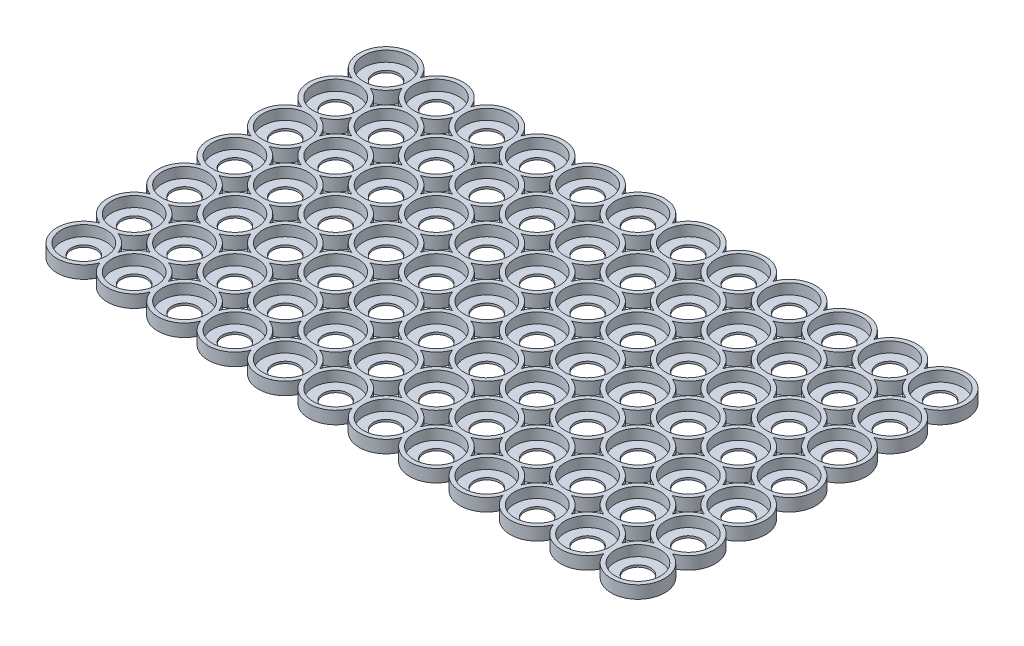
from build123d import *

# Parameters (mm, degrees)
LPATTERN1_COUNT = 7
LPATTERN1_PITCH = 24
LPATTERN2_COUNT = 12
LPATTERN2_PITCH = 24


with BuildPart() as part:
    # Sketch1 → Revolve1 (revolve)
    with BuildSketch(Plane(origin=(0, 0, 0), x_dir=(0, 0, -1), z_dir=(1, 0, 0))):
        Polygon((-12.75, 3), (-12.75, -3), (-6, -3), (-6, -2), (-10.75, -2), (-10.75, 3), align=None)
    revolve1 = revolve(axis=Axis((0, 27.077205882, 0), (0, -1, 0)))

    # LPattern1: Revolve1 ×7
    with Locations(*[(0, 0, -i * LPATTERN1_PITCH) for i in range(1, LPATTERN1_COUNT)]):
        add(revolve1)

    # LPattern2: Revolve1 ×12
    with Locations(*[(i * LPATTERN2_PITCH, 0, 0) for i in range(1, LPATTERN2_COUNT)]):
        add(revolve1)

    # LPattern2 copy 1 sketch → LPattern2 copy 1 (revolve)
    with BuildSketch(Plane(origin=(24, 0, -24), x_dir=(0, 0, -1), z_dir=(1, 0, 0))):
        Polygon((-12.75, 3), (-12.75, -3), (-6, -3), (-6, -2), (-10.75, -2), (-10.75, 3), align=None)
    revolve(axis=Axis((24, 27.077205882, -24), (0, -1, 0)))

    # LPattern2 copy 2 sketch → LPattern2 copy 2 (revolve)
    with BuildSketch(Plane(origin=(48, 0, -24), x_dir=(0, 0, -1), z_dir=(1, 0, 0))):
        Polygon((-12.75, 3), (-12.75, -3), (-6, -3), (-6, -2), (-10.75, -2), (-10.75, 3), align=None)
    revolve(axis=Axis((48, 27.077205882, -24), (0, -1, 0)))

    # LPattern2 copy 3 sketch → LPattern2 copy 3 (revolve)
    with BuildSketch(Plane(origin=(72, 0, -24), x_dir=(0, 0, -1), z_dir=(1, 0, 0))):
        Polygon((-12.75, 3), (-12.75, -3), (-6, -3), (-6, -2), (-10.75, -2), (-10.75, 3), align=None)
    revolve(axis=Axis((72, 27.077205882, -24), (0, -1, 0)))

    # LPattern2 copy 4 sketch → LPattern2 copy 4 (revolve)
    with BuildSketch(Plane(origin=(96, 0, -24), x_dir=(0, 0, -1), z_dir=(1, 0, 0))):
        Polygon((-12.75, 3), (-12.75, -3), (-6, -3), (-6, -2), (-10.75, -2), (-10.75, 3), align=None)
    revolve(axis=Axis((96, 27.077205882, -24), (0, -1, 0)))

    # LPattern2 copy 5 sketch → LPattern2 copy 5 (revolve)
    with BuildSketch(Plane(origin=(120, 0, -24), x_dir=(0, 0, -1), z_dir=(1, 0, 0))):
        Polygon((-12.75, 3), (-12.75, -3), (-6, -3), (-6, -2), (-10.75, -2), (-10.75, 3), align=None)
    revolve(axis=Axis((120, 27.077205882, -24), (0, -1, 0)))

    # LPattern2 copy 6 sketch → LPattern2 copy 6 (revolve)
    with BuildSketch(Plane(origin=(144, 0, -24), x_dir=(0, 0, -1), z_dir=(1, 0, 0))):
        Polygon((-12.75, 3), (-12.75, -3), (-6, -3), (-6, -2), (-10.75, -2), (-10.75, 3), align=None)
    revolve(axis=Axis((144, 27.077205882, -24), (0, -1, 0)))

    # LPattern2 copy 7 sketch → LPattern2 copy 7 (revolve)
    with BuildSketch(Plane(origin=(168, 0, -24), x_dir=(0, 0, -1), z_dir=(1, 0, 0))):
        Polygon((-12.75, 3), (-12.75, -3), (-6, -3), (-6, -2), (-10.75, -2), (-10.75, 3), align=None)
    revolve(axis=Axis((168, 27.077205882, -24), (0, -1, 0)))

    # LPattern2 copy 8 sketch → LPattern2 copy 8 (revolve)
    with BuildSketch(Plane(origin=(192, 0, -24), x_dir=(0, 0, -1), z_dir=(1, 0, 0))):
        Polygon((-12.75, 3), (-12.75, -3), (-6, -3), (-6, -2), (-10.75, -2), (-10.75, 3), align=None)
    revolve(axis=Axis((192, 27.077205882, -24), (0, -1, 0)))

    # LPattern2 copy 9 sketch → LPattern2 copy 9 (revolve)
    with BuildSketch(Plane(origin=(216, 0, -24), x_dir=(0, 0, -1), z_dir=(1, 0, 0))):
        Polygon((-12.75, 3), (-12.75, -3), (-6, -3), (-6, -2), (-10.75, -2), (-10.75, 3), align=None)
    revolve(axis=Axis((216, 27.077205882, -24), (0, -1, 0)))

    # LPattern2 copy 10 sketch → LPattern2 copy 10 (revolve)
    with BuildSketch(Plane(origin=(240, 0, -24), x_dir=(0, 0, -1), z_dir=(1, 0, 0))):
        Polygon((-12.75, 3), (-12.75, -3), (-6, -3), (-6, -2), (-10.75, -2), (-10.75, 3), align=None)
    revolve(axis=Axis((240, 27.077205882, -24), (0, -1, 0)))

    # LPattern2 copy 11 sketch → LPattern2 copy 11 (revolve)
    with BuildSketch(Plane(origin=(264, 0, -24), x_dir=(0, 0, -1), z_dir=(1, 0, 0))):
        Polygon((-12.75, 3), (-12.75, -3), (-6, -3), (-6, -2), (-10.75, -2), (-10.75, 3), align=None)
    revolve(axis=Axis((264, 27.077205882, -24), (0, -1, 0)))

    # LPattern2 copy 12 sketch → LPattern2 copy 12 (revolve)
    with BuildSketch(Plane(origin=(24, 0, -48), x_dir=(0, 0, -1), z_dir=(1, 0, 0))):
        Polygon((-12.75, 3), (-12.75, -3), (-6, -3), (-6, -2), (-10.75, -2), (-10.75, 3), align=None)
    revolve(axis=Axis((24, 27.077205882, -48), (0, -1, 0)))

    # LPattern2 copy 13 sketch → LPattern2 copy 13 (revolve)
    with BuildSketch(Plane(origin=(48, 0, -48), x_dir=(0, 0, -1), z_dir=(1, 0, 0))):
        Polygon((-12.75, 3), (-12.75, -3), (-6, -3), (-6, -2), (-10.75, -2), (-10.75, 3), align=None)
    revolve(axis=Axis((48, 27.077205882, -48), (0, -1, 0)))

    # LPattern2 copy 14 sketch → LPattern2 copy 14 (revolve)
    with BuildSketch(Plane(origin=(72, 0, -48), x_dir=(0, 0, -1), z_dir=(1, 0, 0))):
        Polygon((-12.75, 3), (-12.75, -3), (-6, -3), (-6, -2), (-10.75, -2), (-10.75, 3), align=None)
    revolve(axis=Axis((72, 27.077205882, -48), (0, -1, 0)))

    # LPattern2 copy 15 sketch → LPattern2 copy 15 (revolve)
    with BuildSketch(Plane(origin=(96, 0, -48), x_dir=(0, 0, -1), z_dir=(1, 0, 0))):
        Polygon((-12.75, 3), (-12.75, -3), (-6, -3), (-6, -2), (-10.75, -2), (-10.75, 3), align=None)
    revolve(axis=Axis((96, 27.077205882, -48), (0, -1, 0)))

    # LPattern2 copy 16 sketch → LPattern2 copy 16 (revolve)
    with BuildSketch(Plane(origin=(120, 0, -48), x_dir=(0, 0, -1), z_dir=(1, 0, 0))):
        Polygon((-12.75, 3), (-12.75, -3), (-6, -3), (-6, -2), (-10.75, -2), (-10.75, 3), align=None)
    revolve(axis=Axis((120, 27.077205882, -48), (0, -1, 0)))

    # LPattern2 copy 17 sketch → LPattern2 copy 17 (revolve)
    with BuildSketch(Plane(origin=(144, 0, -48), x_dir=(0, 0, -1), z_dir=(1, 0, 0))):
        Polygon((-12.75, 3), (-12.75, -3), (-6, -3), (-6, -2), (-10.75, -2), (-10.75, 3), align=None)
    revolve(axis=Axis((144, 27.077205882, -48), (0, -1, 0)))

    # LPattern2 copy 18 sketch → LPattern2 copy 18 (revolve)
    with BuildSketch(Plane(origin=(168, 0, -48), x_dir=(0, 0, -1), z_dir=(1, 0, 0))):
        Polygon((-12.75, 3), (-12.75, -3), (-6, -3), (-6, -2), (-10.75, -2), (-10.75, 3), align=None)
    revolve(axis=Axis((168, 27.077205882, -48), (0, -1, 0)))

    # LPattern2 copy 19 sketch → LPattern2 copy 19 (revolve)
    with BuildSketch(Plane(origin=(192, 0, -48), x_dir=(0, 0, -1), z_dir=(1, 0, 0))):
        Polygon((-12.75, 3), (-12.75, -3), (-6, -3), (-6, -2), (-10.75, -2), (-10.75, 3), align=None)
    revolve(axis=Axis((192, 27.077205882, -48), (0, -1, 0)))

    # LPattern2 copy 20 sketch → LPattern2 copy 20 (revolve)
    with BuildSketch(Plane(origin=(216, 0, -48), x_dir=(0, 0, -1), z_dir=(1, 0, 0))):
        Polygon((-12.75, 3), (-12.75, -3), (-6, -3), (-6, -2), (-10.75, -2), (-10.75, 3), align=None)
    revolve(axis=Axis((216, 27.077205882, -48), (0, -1, 0)))

    # LPattern2 copy 21 sketch → LPattern2 copy 21 (revolve)
    with BuildSketch(Plane(origin=(240, 0, -48), x_dir=(0, 0, -1), z_dir=(1, 0, 0))):
        Polygon((-12.75, 3), (-12.75, -3), (-6, -3), (-6, -2), (-10.75, -2), (-10.75, 3), align=None)
    revolve(axis=Axis((240, 27.077205882, -48), (0, -1, 0)))

    # LPattern2 copy 22 sketch → LPattern2 copy 22 (revolve)
    with BuildSketch(Plane(origin=(264, 0, -48), x_dir=(0, 0, -1), z_dir=(1, 0, 0))):
        Polygon((-12.75, 3), (-12.75, -3), (-6, -3), (-6, -2), (-10.75, -2), (-10.75, 3), align=None)
    revolve(axis=Axis((264, 27.077205882, -48), (0, -1, 0)))

    # LPattern2 copy 23 sketch → LPattern2 copy 23 (revolve)
    with BuildSketch(Plane(origin=(24, 0, -72), x_dir=(0, 0, -1), z_dir=(1, 0, 0))):
        Polygon((-12.75, 3), (-12.75, -3), (-6, -3), (-6, -2), (-10.75, -2), (-10.75, 3), align=None)
    revolve(axis=Axis((24, 27.077205882, -72), (0, -1, 0)))

    # LPattern2 copy 24 sketch → LPattern2 copy 24 (revolve)
    with BuildSketch(Plane(origin=(48, 0, -72), x_dir=(0, 0, -1), z_dir=(1, 0, 0))):
        Polygon((-12.75, 3), (-12.75, -3), (-6, -3), (-6, -2), (-10.75, -2), (-10.75, 3), align=None)
    revolve(axis=Axis((48, 27.077205882, -72), (0, -1, 0)))

    # LPattern2 copy 25 sketch → LPattern2 copy 25 (revolve)
    with BuildSketch(Plane(origin=(72, 0, -72), x_dir=(0, 0, -1), z_dir=(1, 0, 0))):
        Polygon((-12.75, 3), (-12.75, -3), (-6, -3), (-6, -2), (-10.75, -2), (-10.75, 3), align=None)
    revolve(axis=Axis((72, 27.077205882, -72), (0, -1, 0)))

    # LPattern2 copy 26 sketch → LPattern2 copy 26 (revolve)
    with BuildSketch(Plane(origin=(96, 0, -72), x_dir=(0, 0, -1), z_dir=(1, 0, 0))):
        Polygon((-12.75, 3), (-12.75, -3), (-6, -3), (-6, -2), (-10.75, -2), (-10.75, 3), align=None)
    revolve(axis=Axis((96, 27.077205882, -72), (0, -1, 0)))

    # LPattern2 copy 27 sketch → LPattern2 copy 27 (revolve)
    with BuildSketch(Plane(origin=(120, 0, -72), x_dir=(0, 0, -1), z_dir=(1, 0, 0))):
        Polygon((-12.75, 3), (-12.75, -3), (-6, -3), (-6, -2), (-10.75, -2), (-10.75, 3), align=None)
    revolve(axis=Axis((120, 27.077205882, -72), (0, -1, 0)))

    # LPattern2 copy 28 sketch → LPattern2 copy 28 (revolve)
    with BuildSketch(Plane(origin=(144, 0, -72), x_dir=(0, 0, -1), z_dir=(1, 0, 0))):
        Polygon((-12.75, 3), (-12.75, -3), (-6, -3), (-6, -2), (-10.75, -2), (-10.75, 3), align=None)
    revolve(axis=Axis((144, 27.077205882, -72), (0, -1, 0)))

    # LPattern2 copy 29 sketch → LPattern2 copy 29 (revolve)
    with BuildSketch(Plane(origin=(168, 0, -72), x_dir=(0, 0, -1), z_dir=(1, 0, 0))):
        Polygon((-12.75, 3), (-12.75, -3), (-6, -3), (-6, -2), (-10.75, -2), (-10.75, 3), align=None)
    revolve(axis=Axis((168, 27.077205882, -72), (0, -1, 0)))

    # LPattern2 copy 30 sketch → LPattern2 copy 30 (revolve)
    with BuildSketch(Plane(origin=(192, 0, -72), x_dir=(0, 0, -1), z_dir=(1, 0, 0))):
        Polygon((-12.75, 3), (-12.75, -3), (-6, -3), (-6, -2), (-10.75, -2), (-10.75, 3), align=None)
    revolve(axis=Axis((192, 27.077205882, -72), (0, -1, 0)))

    # LPattern2 copy 31 sketch → LPattern2 copy 31 (revolve)
    with BuildSketch(Plane(origin=(216, 0, -72), x_dir=(0, 0, -1), z_dir=(1, 0, 0))):
        Polygon((-12.75, 3), (-12.75, -3), (-6, -3), (-6, -2), (-10.75, -2), (-10.75, 3), align=None)
    revolve(axis=Axis((216, 27.077205882, -72), (0, -1, 0)))

    # LPattern2 copy 32 sketch → LPattern2 copy 32 (revolve)
    with BuildSketch(Plane(origin=(240, 0, -72), x_dir=(0, 0, -1), z_dir=(1, 0, 0))):
        Polygon((-12.75, 3), (-12.75, -3), (-6, -3), (-6, -2), (-10.75, -2), (-10.75, 3), align=None)
    revolve(axis=Axis((240, 27.077205882, -72), (0, -1, 0)))

    # LPattern2 copy 33 sketch → LPattern2 copy 33 (revolve)
    with BuildSketch(Plane(origin=(264, 0, -72), x_dir=(0, 0, -1), z_dir=(1, 0, 0))):
        Polygon((-12.75, 3), (-12.75, -3), (-6, -3), (-6, -2), (-10.75, -2), (-10.75, 3), align=None)
    revolve(axis=Axis((264, 27.077205882, -72), (0, -1, 0)))

    # LPattern2 copy 34 sketch → LPattern2 copy 34 (revolve)
    with BuildSketch(Plane(origin=(24, 0, -96), x_dir=(0, 0, -1), z_dir=(1, 0, 0))):
        Polygon((-12.75, 3), (-12.75, -3), (-6, -3), (-6, -2), (-10.75, -2), (-10.75, 3), align=None)
    revolve(axis=Axis((24, 27.077205882, -96), (0, -1, 0)))

    # LPattern2 copy 35 sketch → LPattern2 copy 35 (revolve)
    with BuildSketch(Plane(origin=(48, 0, -96), x_dir=(0, 0, -1), z_dir=(1, 0, 0))):
        Polygon((-12.75, 3), (-12.75, -3), (-6, -3), (-6, -2), (-10.75, -2), (-10.75, 3), align=None)
    revolve(axis=Axis((48, 27.077205882, -96), (0, -1, 0)))

    # LPattern2 copy 36 sketch → LPattern2 copy 36 (revolve)
    with BuildSketch(Plane(origin=(72, 0, -96), x_dir=(0, 0, -1), z_dir=(1, 0, 0))):
        Polygon((-12.75, 3), (-12.75, -3), (-6, -3), (-6, -2), (-10.75, -2), (-10.75, 3), align=None)
    revolve(axis=Axis((72, 27.077205882, -96), (0, -1, 0)))

    # LPattern2 copy 37 sketch → LPattern2 copy 37 (revolve)
    with BuildSketch(Plane(origin=(96, 0, -96), x_dir=(0, 0, -1), z_dir=(1, 0, 0))):
        Polygon((-12.75, 3), (-12.75, -3), (-6, -3), (-6, -2), (-10.75, -2), (-10.75, 3), align=None)
    revolve(axis=Axis((96, 27.077205882, -96), (0, -1, 0)))

    # LPattern2 copy 38 sketch → LPattern2 copy 38 (revolve)
    with BuildSketch(Plane(origin=(120, 0, -96), x_dir=(0, 0, -1), z_dir=(1, 0, 0))):
        Polygon((-12.75, 3), (-12.75, -3), (-6, -3), (-6, -2), (-10.75, -2), (-10.75, 3), align=None)
    revolve(axis=Axis((120, 27.077205882, -96), (0, -1, 0)))

    # LPattern2 copy 39 sketch → LPattern2 copy 39 (revolve)
    with BuildSketch(Plane(origin=(144, 0, -96), x_dir=(0, 0, -1), z_dir=(1, 0, 0))):
        Polygon((-12.75, 3), (-12.75, -3), (-6, -3), (-6, -2), (-10.75, -2), (-10.75, 3), align=None)
    revolve(axis=Axis((144, 27.077205882, -96), (0, -1, 0)))

    # LPattern2 copy 40 sketch → LPattern2 copy 40 (revolve)
    with BuildSketch(Plane(origin=(168, 0, -96), x_dir=(0, 0, -1), z_dir=(1, 0, 0))):
        Polygon((-12.75, 3), (-12.75, -3), (-6, -3), (-6, -2), (-10.75, -2), (-10.75, 3), align=None)
    revolve(axis=Axis((168, 27.077205882, -96), (0, -1, 0)))

    # LPattern2 copy 41 sketch → LPattern2 copy 41 (revolve)
    with BuildSketch(Plane(origin=(192, 0, -96), x_dir=(0, 0, -1), z_dir=(1, 0, 0))):
        Polygon((-12.75, 3), (-12.75, -3), (-6, -3), (-6, -2), (-10.75, -2), (-10.75, 3), align=None)
    revolve(axis=Axis((192, 27.077205882, -96), (0, -1, 0)))

    # LPattern2 copy 42 sketch → LPattern2 copy 42 (revolve)
    with BuildSketch(Plane(origin=(216, 0, -96), x_dir=(0, 0, -1), z_dir=(1, 0, 0))):
        Polygon((-12.75, 3), (-12.75, -3), (-6, -3), (-6, -2), (-10.75, -2), (-10.75, 3), align=None)
    revolve(axis=Axis((216, 27.077205882, -96), (0, -1, 0)))

    # LPattern2 copy 43 sketch → LPattern2 copy 43 (revolve)
    with BuildSketch(Plane(origin=(240, 0, -96), x_dir=(0, 0, -1), z_dir=(1, 0, 0))):
        Polygon((-12.75, 3), (-12.75, -3), (-6, -3), (-6, -2), (-10.75, -2), (-10.75, 3), align=None)
    revolve(axis=Axis((240, 27.077205882, -96), (0, -1, 0)))

    # LPattern2 copy 44 sketch → LPattern2 copy 44 (revolve)
    with BuildSketch(Plane(origin=(264, 0, -96), x_dir=(0, 0, -1), z_dir=(1, 0, 0))):
        Polygon((-12.75, 3), (-12.75, -3), (-6, -3), (-6, -2), (-10.75, -2), (-10.75, 3), align=None)
    revolve(axis=Axis((264, 27.077205882, -96), (0, -1, 0)))

    # LPattern2 copy 45 sketch → LPattern2 copy 45 (revolve)
    with BuildSketch(Plane(origin=(24, 0, -120), x_dir=(0, 0, -1), z_dir=(1, 0, 0))):
        Polygon((-12.75, 3), (-12.75, -3), (-6, -3), (-6, -2), (-10.75, -2), (-10.75, 3), align=None)
    revolve(axis=Axis((24, 27.077205882, -120), (0, -1, 0)))

    # LPattern2 copy 46 sketch → LPattern2 copy 46 (revolve)
    with BuildSketch(Plane(origin=(48, 0, -120), x_dir=(0, 0, -1), z_dir=(1, 0, 0))):
        Polygon((-12.75, 3), (-12.75, -3), (-6, -3), (-6, -2), (-10.75, -2), (-10.75, 3), align=None)
    revolve(axis=Axis((48, 27.077205882, -120), (0, -1, 0)))

    # LPattern2 copy 47 sketch → LPattern2 copy 47 (revolve)
    with BuildSketch(Plane(origin=(72, 0, -120), x_dir=(0, 0, -1), z_dir=(1, 0, 0))):
        Polygon((-12.75, 3), (-12.75, -3), (-6, -3), (-6, -2), (-10.75, -2), (-10.75, 3), align=None)
    revolve(axis=Axis((72, 27.077205882, -120), (0, -1, 0)))

    # LPattern2 copy 48 sketch → LPattern2 copy 48 (revolve)
    with BuildSketch(Plane(origin=(96, 0, -120), x_dir=(0, 0, -1), z_dir=(1, 0, 0))):
        Polygon((-12.75, 3), (-12.75, -3), (-6, -3), (-6, -2), (-10.75, -2), (-10.75, 3), align=None)
    revolve(axis=Axis((96, 27.077205882, -120), (0, -1, 0)))

    # LPattern2 copy 49 sketch → LPattern2 copy 49 (revolve)
    with BuildSketch(Plane(origin=(120, 0, -120), x_dir=(0, 0, -1), z_dir=(1, 0, 0))):
        Polygon((-12.75, 3), (-12.75, -3), (-6, -3), (-6, -2), (-10.75, -2), (-10.75, 3), align=None)
    revolve(axis=Axis((120, 27.077205882, -120), (0, -1, 0)))

    # LPattern2 copy 50 sketch → LPattern2 copy 50 (revolve)
    with BuildSketch(Plane(origin=(144, 0, -120), x_dir=(0, 0, -1), z_dir=(1, 0, 0))):
        Polygon((-12.75, 3), (-12.75, -3), (-6, -3), (-6, -2), (-10.75, -2), (-10.75, 3), align=None)
    revolve(axis=Axis((144, 27.077205882, -120), (0, -1, 0)))

    # LPattern2 copy 51 sketch → LPattern2 copy 51 (revolve)
    with BuildSketch(Plane(origin=(168, 0, -120), x_dir=(0, 0, -1), z_dir=(1, 0, 0))):
        Polygon((-12.75, 3), (-12.75, -3), (-6, -3), (-6, -2), (-10.75, -2), (-10.75, 3), align=None)
    revolve(axis=Axis((168, 27.077205882, -120), (0, -1, 0)))

    # LPattern2 copy 52 sketch → LPattern2 copy 52 (revolve)
    with BuildSketch(Plane(origin=(192, 0, -120), x_dir=(0, 0, -1), z_dir=(1, 0, 0))):
        Polygon((-12.75, 3), (-12.75, -3), (-6, -3), (-6, -2), (-10.75, -2), (-10.75, 3), align=None)
    revolve(axis=Axis((192, 27.077205882, -120), (0, -1, 0)))

    # LPattern2 copy 53 sketch → LPattern2 copy 53 (revolve)
    with BuildSketch(Plane(origin=(216, 0, -120), x_dir=(0, 0, -1), z_dir=(1, 0, 0))):
        Polygon((-12.75, 3), (-12.75, -3), (-6, -3), (-6, -2), (-10.75, -2), (-10.75, 3), align=None)
    revolve(axis=Axis((216, 27.077205882, -120), (0, -1, 0)))

    # LPattern2 copy 54 sketch → LPattern2 copy 54 (revolve)
    with BuildSketch(Plane(origin=(240, 0, -120), x_dir=(0, 0, -1), z_dir=(1, 0, 0))):
        Polygon((-12.75, 3), (-12.75, -3), (-6, -3), (-6, -2), (-10.75, -2), (-10.75, 3), align=None)
    revolve(axis=Axis((240, 27.077205882, -120), (0, -1, 0)))

    # LPattern2 copy 55 sketch → LPattern2 copy 55 (revolve)
    with BuildSketch(Plane(origin=(264, 0, -120), x_dir=(0, 0, -1), z_dir=(1, 0, 0))):
        Polygon((-12.75, 3), (-12.75, -3), (-6, -3), (-6, -2), (-10.75, -2), (-10.75, 3), align=None)
    revolve(axis=Axis((264, 27.077205882, -120), (0, -1, 0)))

    # LPattern2 copy 56 sketch → LPattern2 copy 56 (revolve)
    with BuildSketch(Plane(origin=(24, 0, -144), x_dir=(0, 0, -1), z_dir=(1, 0, 0))):
        Polygon((-12.75, 3), (-12.75, -3), (-6, -3), (-6, -2), (-10.75, -2), (-10.75, 3), align=None)
    revolve(axis=Axis((24, 27.077205882, -144), (0, -1, 0)))

    # LPattern2 copy 57 sketch → LPattern2 copy 57 (revolve)
    with BuildSketch(Plane(origin=(48, 0, -144), x_dir=(0, 0, -1), z_dir=(1, 0, 0))):
        Polygon((-12.75, 3), (-12.75, -3), (-6, -3), (-6, -2), (-10.75, -2), (-10.75, 3), align=None)
    revolve(axis=Axis((48, 27.077205882, -144), (0, -1, 0)))

    # LPattern2 copy 58 sketch → LPattern2 copy 58 (revolve)
    with BuildSketch(Plane(origin=(72, 0, -144), x_dir=(0, 0, -1), z_dir=(1, 0, 0))):
        Polygon((-12.75, 3), (-12.75, -3), (-6, -3), (-6, -2), (-10.75, -2), (-10.75, 3), align=None)
    revolve(axis=Axis((72, 27.077205882, -144), (0, -1, 0)))

    # LPattern2 copy 59 sketch → LPattern2 copy 59 (revolve)
    with BuildSketch(Plane(origin=(96, 0, -144), x_dir=(0, 0, -1), z_dir=(1, 0, 0))):
        Polygon((-12.75, 3), (-12.75, -3), (-6, -3), (-6, -2), (-10.75, -2), (-10.75, 3), align=None)
    revolve(axis=Axis((96, 27.077205882, -144), (0, -1, 0)))

    # LPattern2 copy 60 sketch → LPattern2 copy 60 (revolve)
    with BuildSketch(Plane(origin=(120, 0, -144), x_dir=(0, 0, -1), z_dir=(1, 0, 0))):
        Polygon((-12.75, 3), (-12.75, -3), (-6, -3), (-6, -2), (-10.75, -2), (-10.75, 3), align=None)
    revolve(axis=Axis((120, 27.077205882, -144), (0, -1, 0)))

    # LPattern2 copy 61 sketch → LPattern2 copy 61 (revolve)
    with BuildSketch(Plane(origin=(144, 0, -144), x_dir=(0, 0, -1), z_dir=(1, 0, 0))):
        Polygon((-12.75, 3), (-12.75, -3), (-6, -3), (-6, -2), (-10.75, -2), (-10.75, 3), align=None)
    revolve(axis=Axis((144, 27.077205882, -144), (0, -1, 0)))

    # LPattern2 copy 62 sketch → LPattern2 copy 62 (revolve)
    with BuildSketch(Plane(origin=(168, 0, -144), x_dir=(0, 0, -1), z_dir=(1, 0, 0))):
        Polygon((-12.75, 3), (-12.75, -3), (-6, -3), (-6, -2), (-10.75, -2), (-10.75, 3), align=None)
    revolve(axis=Axis((168, 27.077205882, -144), (0, -1, 0)))

    # LPattern2 copy 63 sketch → LPattern2 copy 63 (revolve)
    with BuildSketch(Plane(origin=(192, 0, -144), x_dir=(0, 0, -1), z_dir=(1, 0, 0))):
        Polygon((-12.75, 3), (-12.75, -3), (-6, -3), (-6, -2), (-10.75, -2), (-10.75, 3), align=None)
    revolve(axis=Axis((192, 27.077205882, -144), (0, -1, 0)))

    # LPattern2 copy 64 sketch → LPattern2 copy 64 (revolve)
    with BuildSketch(Plane(origin=(216, 0, -144), x_dir=(0, 0, -1), z_dir=(1, 0, 0))):
        Polygon((-12.75, 3), (-12.75, -3), (-6, -3), (-6, -2), (-10.75, -2), (-10.75, 3), align=None)
    revolve(axis=Axis((216, 27.077205882, -144), (0, -1, 0)))

    # LPattern2 copy 65 sketch → LPattern2 copy 65 (revolve)
    with BuildSketch(Plane(origin=(240, 0, -144), x_dir=(0, 0, -1), z_dir=(1, 0, 0))):
        Polygon((-12.75, 3), (-12.75, -3), (-6, -3), (-6, -2), (-10.75, -2), (-10.75, 3), align=None)
    revolve(axis=Axis((240, 27.077205882, -144), (0, -1, 0)))

    # LPattern2 copy 66 sketch → LPattern2 copy 66 (revolve)
    with BuildSketch(Plane(origin=(264, 0, -144), x_dir=(0, 0, -1), z_dir=(1, 0, 0))):
        Polygon((-12.75, 3), (-12.75, -3), (-6, -3), (-6, -2), (-10.75, -2), (-10.75, 3), align=None)
    revolve(axis=Axis((264, 27.077205882, -144), (0, -1, 0)))


solid = part.part
